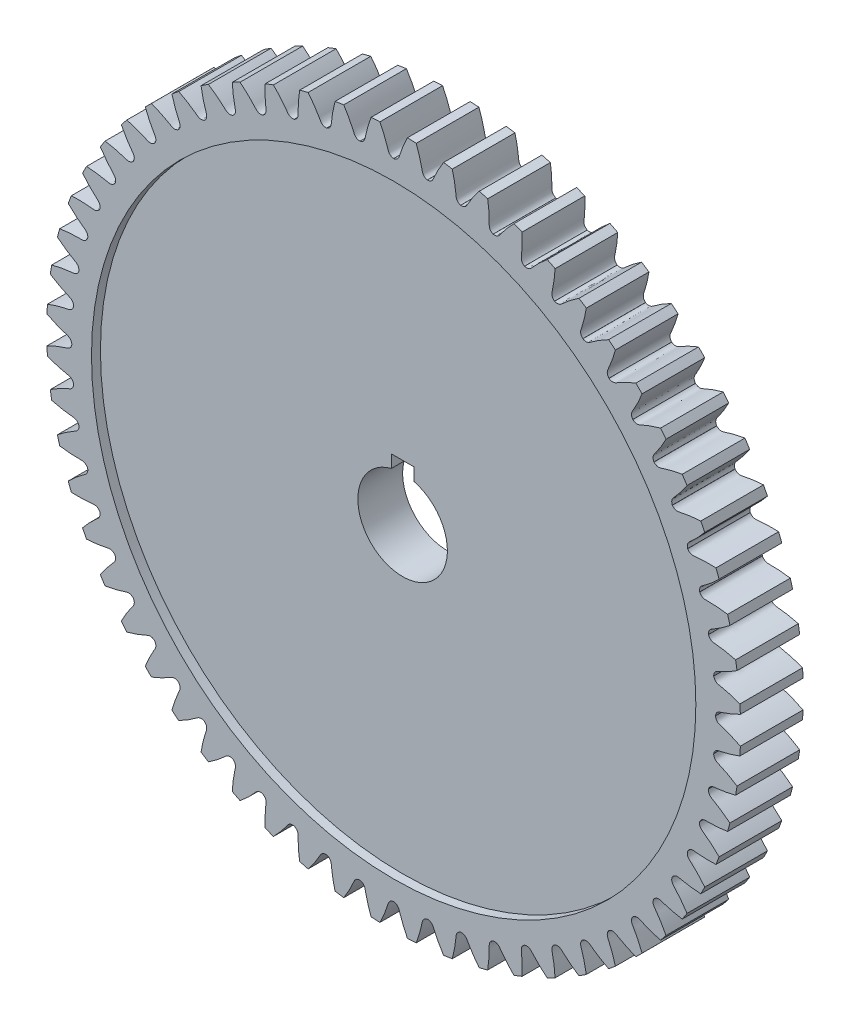
from build123d import *

# Parameters (mm, degrees)
SKETCH_1_R               = 77.5
EXTRUDE_1_DEPTH          = 14
CUT_EXTRUDE_1_DEPTH      = 111.492081164
PATTERN_CIRCULAR_1_COUNT = 60
CUT_EXTRUDE_2_DEPTH      = 50
SKETCH_7_R               = 67.5
CUT_EXTRUDE_3_DEPTH      = 2
CUT_EXTRUDE_START        = -2
SKETCH_8_R               = 67.5
CUT_EXTRUDE_4_DEPTH      = 2


with BuildPart() as part:
    # 草图1 → 凸台-拉伸1 (new body)
    with BuildSketch(Plane.XY):
        Circle(SKETCH_1_R)
    extrude(amount=EXTRUDE_1_DEPTH)

    # 草图2 → 切除-拉伸1 (cut, through all)
    with BuildSketch(Plane.XY):
        with BuildLine():
            ThreePointArc((0.01, 71.874887866), (0, 71.874888561), (-0.01, 71.874887866))
            add(Edge.make_bspline(
                [(-0.01, 71.874887866), (-1.072252001, 72.04087675), (-1.238444195, 72.910319329), (-1.559675646, 73.875584225), (-1.71008125, 74.307888736), (-1.879644875, 74.763087607), (-2.068417143, 75.241155933), (-2.277645859, 75.741327678), (-2.508207856, 76.263014737), (-2.761065538, 76.805539301), (-3.037133251, 77.368212171), (-3.337314934, 77.950310701), (-3.662492277, 78.551085774), (-4.013527149, 79.169760447), (-4.391259944, 79.805531009), (-4.796509116, 80.457567373), (-5.230070387, 81.125013681), (-5.692716068, 81.806988872), (-6.185194363, 82.502587284), (-6.708228706, 83.210879269), (-7.26251708, 83.930911825), (-7.848731454, 84.661709243), (-8.467516863, 85.402273779), (-9.349153998, 86.415536082), (-10.042862128, 87.16549222), (-10.521380102, 87.663046221)],
                knots=[0, 0, 0, 0, 0.113063601, 0.135455027, 0.159316546, 0.184648158, 0.211449864, 0.239721663, 0.269463555, 0.300675541, 0.33335762, 0.367509792, 0.403132057, 0.440224416, 0.478786868, 0.518819414, 0.560322052, 0.603294784, 0.64773761, 0.693650528, 0.74103354, 0.789886646, 0.840209844, 0.892003136, 1, 1, 1, 1], degree=3))
            ThreePointArc((-10.521380102, 87.663046221), (0, 88.292180356), (10.521380102, 87.663046221))
            add(Edge.make_bspline(
                [(0.01, 71.874887866), (1.072252001, 72.04087675), (1.238444195, 72.910319329), (1.559675646, 73.875584225), (1.71008125, 74.307888736), (1.879644875, 74.763087607), (2.068417143, 75.241155933), (2.277645859, 75.741327678), (2.508207856, 76.263014737), (2.761065538, 76.805539301), (3.037133251, 77.368212171), (3.337314934, 77.950310701), (3.662492277, 78.551085774), (4.013527149, 79.169760447), (4.391259944, 79.805531009), (4.796509116, 80.457567373), (5.230070387, 81.125013681), (5.692716068, 81.806988872), (6.185194363, 82.502587284), (6.708228706, 83.210879269), (7.26251708, 83.930911825), (7.848731454, 84.661709243), (8.467516863, 85.402273779), (9.349153998, 86.415536082), (10.042862128, 87.16549222), (10.521380102, 87.663046221)],
                knots=[0, 0, 0, 0, 0.113063601, 0.135455027, 0.159316546, 0.184648158, 0.211449864, 0.239721663, 0.269463555, 0.300675541, 0.33335762, 0.367509792, 0.403132057, 0.440224416, 0.478786868, 0.518819414, 0.560322052, 0.603294784, 0.64773761, 0.693650528, 0.74103354, 0.789886646, 0.840209844, 0.892003136, 1, 1, 1, 1], degree=3))
        make_face()
    cut_extrude_1 = extrude(amount=CUT_EXTRUDE_1_DEPTH, mode=Mode.SUBTRACT)

    # 阵列(圆周)1: 切除-拉伸1 ×60 about axis
    pattern_circular_1_axis = Axis((0, 0, 14), (0, 0, -1))
    for i in range(1, PATTERN_CIRCULAR_1_COUNT):
        add(cut_extrude_1.rotate(pattern_circular_1_axis, i * 360 / PATTERN_CIRCULAR_1_COUNT), mode=Mode.SUBTRACT)

    # 草图6 → 切除-拉伸2 (cut)
    with BuildSketch(Plane.XY.offset(14)):
        with BuildLine():
            Line((-2.5, 12.5), (2.5, 12.5))
            Line((2.5, 12.5), (2.5, 9.682458366))
            ThreePointArc((2.5, 9.682458366), (0, -10), (-2.5, 9.682458366))
            Line((-2.5, 9.682458366), (-2.5, 12.5))
        make_face()
    extrude(amount=-CUT_EXTRUDE_2_DEPTH, mode=Mode.SUBTRACT)

    # 草图7 → 切除-拉伸3 (cut)
    with BuildSketch(Plane(origin=(0, 0, 0), x_dir=(-1, 0, 0), z_dir=(0, 0, -1))):
        Circle(SKETCH_7_R)
    extrude(amount=-CUT_EXTRUDE_3_DEPTH, mode=Mode.SUBTRACT)

    # 草图8 → 切除-拉伸4 (cut)
    with BuildSketch(Plane.XY.offset(14).offset(CUT_EXTRUDE_START)):
        Circle(SKETCH_8_R)
    extrude(amount=CUT_EXTRUDE_4_DEPTH, mode=Mode.SUBTRACT)


solid = part.part
